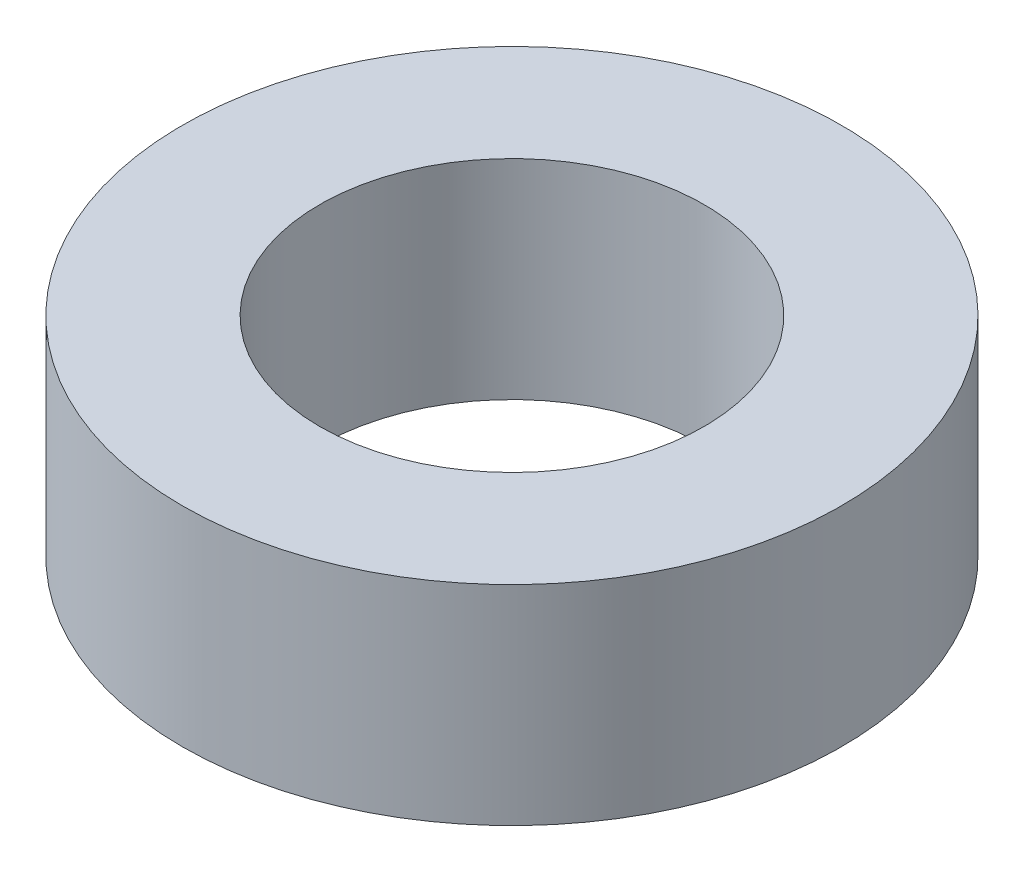
from build123d import *

# Parameters (mm, degrees)
SKETCH1_R           = 30
BOSS_EXTRUDE1_DEPTH = 19
SKETCH2_R           = 17.5
CUT_EXTRUDE1_DEPTH  = 47.486557197


with BuildPart() as part:
    # Sketch1 → Boss-Extrude1 (new body)
    with BuildSketch(Plane(origin=(0, 0, 0), x_dir=(1, 0, 0), z_dir=(0, 1, 0))):
        Circle(SKETCH1_R)
    extrude(amount=BOSS_EXTRUDE1_DEPTH)

    # Sketch2 → Cut-Extrude1 (cut, through all)
    with BuildSketch(Plane(origin=(0, 0, 0), x_dir=(1, 0, 0), z_dir=(0, 1, 0))):
        Circle(SKETCH2_R)
    extrude(amount=CUT_EXTRUDE1_DEPTH, mode=Mode.SUBTRACT)


solid = part.part
